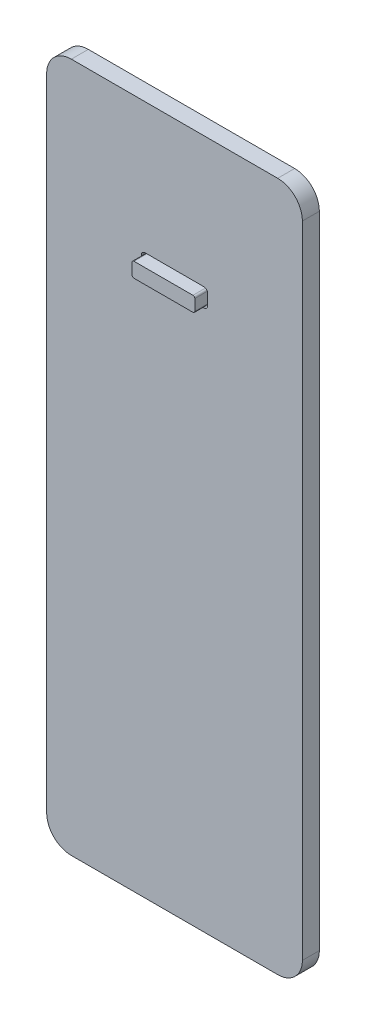
from build123d import *

# Parameters (mm, degrees)
STOCK_PB_TOP_LID_SM_1_START = 11.200003695
STOCK_PB_TOP_LID_SM_1_DEPTH = 2.3
BOSS_EXTRUDE1_DEPTH         = 3.8
BOSS_EXTRUDE2_DEPTH         = 2
SKETCH5_R                   = 2.5
BOSS_EXTRUDE3_DEPTH         = 5.2


# Read off the part's stored shape, not the designer's step: Stock-pb_top_lid_sm-1
with BuildPart() as part:
    # Stock-pb_top_lid_sm-1 outline → Stock-pb_top_lid_sm-1 (new body)
    with BuildSketch(Plane(origin=(0, 0, 0), x_dir=(1, 0, 0), z_dir=(0, 1.3113422028449806e-07, -0.9999999999999915)).offset(STOCK_PB_TOP_LID_SM_1_START)):
        with BuildLine():
            Line((-3.5, -24.849998248), (24.5, -24.849998482))
            ThreePointArc((24.5, -24.849998482), (26.868807895, -23.868806125), (27.850000252, -21.49999823))
            Line((27.850000252, -21.49999823), (27.85, 65.381136149))
            ThreePointArc((27.85, 65.381136149), (26.868807717, 67.749943866), (24.5, 68.731136149))
            Line((24.5, 68.731136149), (-3.5, 68.731136149))
            ThreePointArc((-3.5, 68.731136149), (-5.868807606, 67.749943977), (-6.85, 65.381136463))
            Line((-6.85, 65.381136463), (-6.850000018, -21.49999823))
            ThreePointArc((-6.850000018, -21.49999823), (-5.86880773, -23.86880596), (-3.5, -24.849998248))
        make_face()
        with BuildLine():
            ThreePointArc((14.500000108, -4.599998248), (14.853553499, -4.746444857), (15.000000108, -5.099998248))
            Line((15.000000108, -5.099998248), (15.000000108, -6.599997786))
            ThreePointArc((15.000000108, -6.599997786), (14.853553662, -6.953551475), (14.500000108, -7.099998248))
            Line((14.500000108, -7.099998248), (6.500000108, -7.099998248))
            ThreePointArc((6.500000108, -7.099998248), (6.146446718, -6.953551638), (6.000000108, -6.599998248))
            Line((6.000000108, -6.599998248), (6.000000108, -5.099998248))
            ThreePointArc((6.000000108, -5.099998248), (6.146446717, -4.746444858), (6.500000108, -4.599998248))
            Line((6.500000108, -4.599998248), (14.500000108, -4.599998248))
        make_face(mode=Mode.SUBTRACT)
    extrude(amount=STOCK_PB_TOP_LID_SM_1_DEPTH)


with BuildPart() as body_2:
    # Sketch3 → Boss-Extrude1 (new body)
    with BuildSketch(Plane(origin=(0, 1.77e-06, -13.500003695), x_dir=(-1, 0, 0), z_dir=(0, 1.3113422028449777e-07, -0.9999999999999915))):
        with BuildLine():
            Line((-14.500000108, 4.849998248), (-6.500000108, 4.849998248))
            ThreePointArc((-6.500000108, 4.849998248), (-6.323223413, 4.923221552), (-6.250000108, 5.099998248))
            Line((-6.250000108, 5.099998248), (-6.250000108, 6.599998248))
            ThreePointArc((-6.250000108, 6.599998248), (-6.323223413, 6.776774943), (-6.500000108, 6.849998248))
            Line((-6.500000108, 6.849998248), (-14.500000108, 6.849998248))
            ThreePointArc((-14.500000108, 6.849998248), (-14.676776803, 6.776774943), (-14.750000108, 6.599998248))
            Line((-14.750000108, 6.599998248), (-14.750000108, 5.099998248))
            ThreePointArc((-14.750000108, 5.099998248), (-14.676776803, 4.923221552), (-14.500000108, 4.849998248))
        make_face()
    extrude(amount=-BOSS_EXTRUDE1_DEPTH)

    # Sketch4 → Boss-Extrude2 (add)
    with BuildSketch(Plane(origin=(0, 1.77e-06, -13.500003695), x_dir=(-1, 0, 0), z_dir=(0, 1.311342202844978e-07, -0.9999999999999915))):
        with BuildLine():
            Line((-4.250000108, 5.099998248), (-4.250000108, 6.599998248))
            ThreePointArc((-4.250000108, 6.599998248), (-4.909009851, 8.190988505), (-6.500000108, 8.849998248))
            Line((-6.500000108, 8.849998248), (-14.500000108, 8.849998248))
            ThreePointArc((-14.500000108, 8.849998248), (-16.090990366, 8.190988505), (-16.750000108, 6.599998248))
            Line((-16.750000108, 6.599998248), (-16.750000108, 5.099998248))
            ThreePointArc((-16.750000108, 5.099998248), (-16.090990366, 3.50900799), (-14.500000108, 2.849998248))
            Line((-14.500000108, 2.849998248), (-6.500000108, 2.849998248))
            ThreePointArc((-6.500000108, 2.849998248), (-4.909009851, 3.50900799), (-4.250000108, 5.099998248))
        make_face()
    extrude(amount=BOSS_EXTRUDE2_DEPTH)

    # Sketch5 → Boss-Extrude3 (add)
    with BuildSketch(Plane(origin=(0, 2.033e-06, -15.500003695), x_dir=(-1, 0, 0), z_dir=(0, 1.3113422028449782e-07, -0.9999999999999915))):
        with Locations(Location((-10.500000108, 5.849998248, 0), (0, 0, 90))):
            Circle(SKETCH5_R)
    extrude(amount=BOSS_EXTRUDE3_DEPTH)


solid = Compound([part.part, body_2.part])
